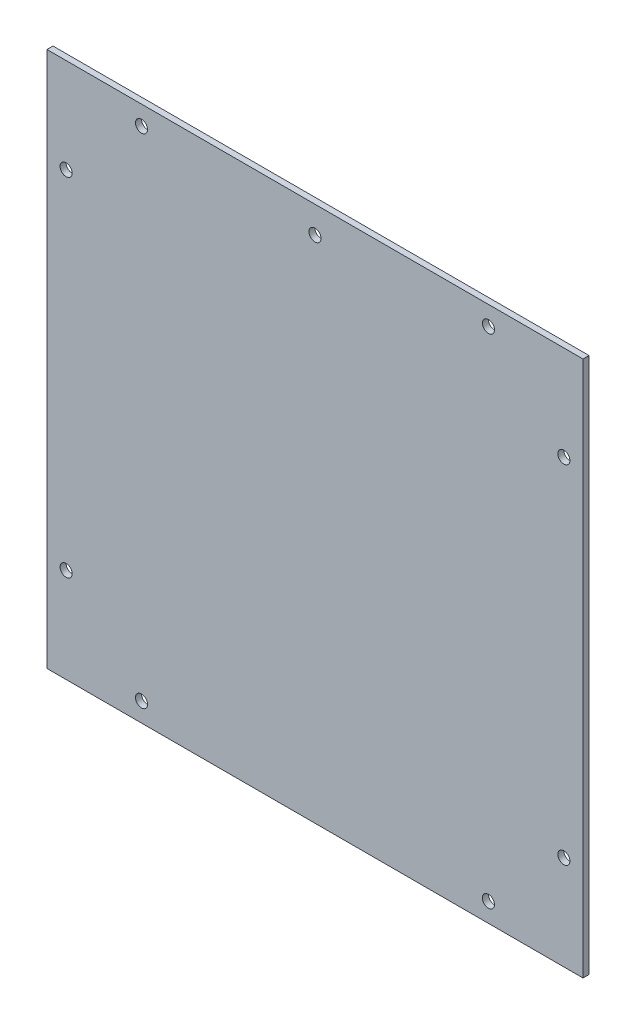
from build123d import *

# Parameters (mm, degrees)
SKETCH2_W           = 355.4
SKETCH2_H           = 355.4
SKETCH2_R           = 4
BOSS_EXTRUDE2_DEPTH = 4


with BuildPart() as part:
    # Sketch2 → Boss-Extrude2 (new body)
    with BuildSketch(Plane.XY):
        Rectangle(SKETCH2_W, SKETCH2_H)
        with Locations((-115, 165)):
            Circle(SKETCH2_R, mode=Mode.SUBTRACT)
        with Locations((-165, 115)):
            Circle(SKETCH2_R, mode=Mode.SUBTRACT)
        with Locations((-165, -115)):
            Circle(SKETCH2_R, mode=Mode.SUBTRACT)
        with Locations((-115, -165)):
            Circle(SKETCH2_R, mode=Mode.SUBTRACT)
        with Locations((115, -165)):
            Circle(SKETCH2_R, mode=Mode.SUBTRACT)
        with Locations((165, -115)):
            Circle(SKETCH2_R, mode=Mode.SUBTRACT)
        with Locations((165, 115)):
            Circle(SKETCH2_R, mode=Mode.SUBTRACT)
        with Locations((115, 165)):
            Circle(SKETCH2_R, mode=Mode.SUBTRACT)
        with Locations((0, 160)):
            Circle(SKETCH2_R, mode=Mode.SUBTRACT)
    extrude(amount=BOSS_EXTRUDE2_DEPTH)


solid = part.part
